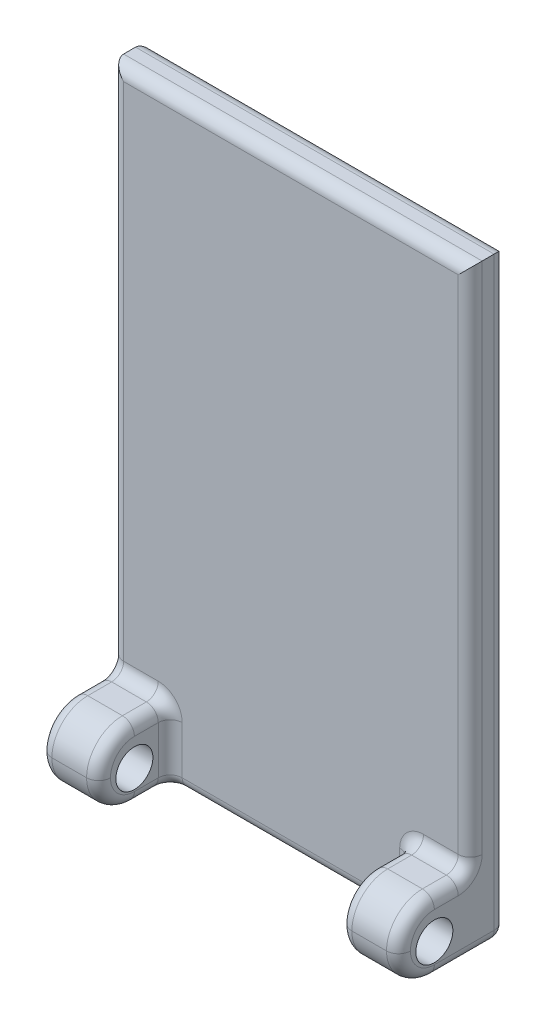
from build123d import *

# Parameters (mm, degrees)
SKETCH1_W           = 30
SKETCH1_H           = 50
BOSS_EXTRUDE1_DEPTH = 3
SKETCH2_W           = 4.9
SKETCH2_H           = 6
BOSS_EXTRUDE2_DEPTH = 6
SKETCH3_R           = 1.55
CUT_EXTRUDE1_DEPTH  = 41.074929819
FILLET1_R           = 3
FILLET2_R           = 1


with BuildPart() as part:
    # Sketch1 → Boss-Extrude1 (new body)
    with BuildSketch(Plane.XY):
        Rectangle(SKETCH1_W, SKETCH1_H)
    extrude(amount=BOSS_EXTRUDE1_DEPTH)

    # Sketch2 → Boss-Extrude2 (add)
    with BuildSketch(Plane.XY.offset(3)):
        with Locations((-12.55, -22)):
            Rectangle(SKETCH2_W, SKETCH2_H)
    boss_extrude2 = extrude(amount=BOSS_EXTRUDE2_DEPTH)

    # Sketch3 → Cut-Extrude1 (cut, through all)
    with BuildSketch(Plane.ZY.offset(15)):
        with Locations((6, -22.3)):
            Circle(SKETCH3_R)
    cut_extrude1 = extrude(amount=-CUT_EXTRUDE1_DEPTH, mode=Mode.SUBTRACT)

    # Mirror1: Boss-Extrude2, Cut-Extrude1 across plane
    add(boss_extrude2.mirror(Plane(origin=(0, 0, 0), x_dir=(0, 0, 1), z_dir=(1, 0, 0))))
    add(cut_extrude1.mirror(Plane(origin=(0, 0, 0), x_dir=(0, 0, 1), z_dir=(1, 0, 0))), mode=Mode.SUBTRACT)

    # Fillet1
    fillet1_edges = [part.edges().sort_by_distance(p)[0] for p in [
        (12.55, -19, 9),
        (12.55, -25, 9),
        (-12.55, -19, 9),
        (-12.55, -25, 9),
    ]]
    fillet(fillet1_edges, radius=FILLET1_R - 0.0001)  # a hair under: the kernel refuses the full size

    # Fillet2
    fillet2_edges = [part.edges().sort_by_distance(p)[0] for p in [
        (-15, 3, 3),
        (0, -25, 3),
        (-10.1, -22, 3),
        (-12.55, -19, 3),
        (15, 3, 3),
        (10.1, -22, 3),
        (12.55, -19, 3),
        (0, -25, 0),
        (15, -25, 3.00005),
        (10.1, -25, 4.50005),
        (-10.1, -25, 4.50005),
        (-15, -25, 3.00005),
        (10.1, -19, 4.50005),
        (-15, 0, 0),
        (10.1, -19.878650367, 8.121349633),
        (10.1, -24.121349633, 8.121349633),
        (15, -19, 4.50005),
        (15, -19.878650367, 8.121349633),
        (15, -24.121349633, 8.121349633),
        (-15, -19, 4.50005),
        (-15, -24.121349633, 8.121349633),
        (0, 25, 0),
        (-15, -19.878650367, 8.121349633),
        (-10.1, -19, 4.50005),
        (-10.1, -24.121349633, 8.121349633),
        (-10.1, -19.878650367, 8.121349633),
        (15, 0, 0),
        (0, 25, 3),
    ]]
    fillet(fillet2_edges, radius=FILLET2_R)


solid = part.part
